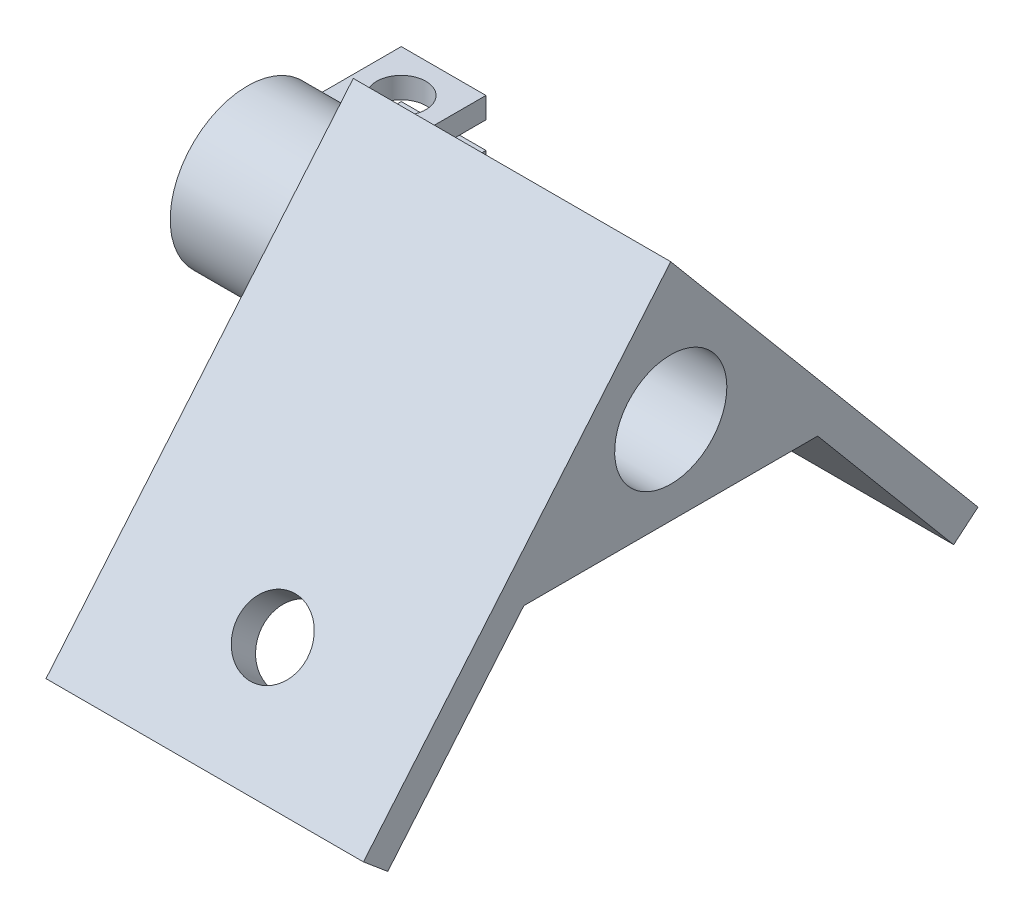
from build123d import *

# Parameters (mm, degrees)
SKETCH1_R            = 5.3
BOSS_EXTRUDE1_DEPTH  = 15
M6_CLEARANCE_HOLE1_D = 6.6
BOSS_EXTRUDE3_START  = 2
BOSS_EXTRUDE3_DEPTH  = 2
BOSS_EXTRUDE2_START  = 8
BOSS_EXTRUDE2_DEPTH  = 8
SKETCH6_R            = 2.325
CUT_EXTRUDE1_DEPTH   = 47.799531686


with BuildPart() as part:
    # Sketch1 → Boss-Extrude1 (new, symmetric)
    with BuildSketch(Plane(origin=(0, 0, 0), x_dir=(0, 0, -1), z_dir=(1, 0, 0))):
        Polygon((0, 12.912507763), (-29.037071095, -21.692526033), (-26.738937766, -23.620888862), (-13.883185572, -8.3), (13.883185572, -8.3), (26.738937766, -23.620888862), (29.037071095, -21.692526033), align=None)
        Circle(SKETCH1_R, mode=Mode.SUBTRACT)
    extrude(amount=BOSS_EXTRUDE1_DEPTH, both=True)

    # M6 Clearance Hole1 (through all)
    with Locations(Plane(origin=(0, 3.406774331, 4.060035549), x_dir=(-1, 0, 0), z_dir=(0, -0.6427876096865407, -0.766044443118977))):
        with Locations((0, -25.282108547)):
            m6_clearance_hole1 = Hole(M6_CLEARANCE_HOLE1_D / 2)

    # Mirror1: M6 Clearance Hole1 across plane
    add(m6_clearance_hole1.mirror(Plane.XY), mode=Mode.SUBTRACT)

    # Sketch7 → Boss-Extrude3 (add)
    with BuildSketch(Plane.ZY.offset(15).offset(BOSS_EXTRUDE3_START)):
        with BuildLine():
            Line((-5.150485414, 1.25), (-7.192183257, 1.25))
            ThreePointArc((-7.192183257, 1.25), (7.3, 0), (-7.192183257, -1.25))
            Line((-7.192183257, -1.25), (-5.150485414, -1.25))
            ThreePointArc((-5.150485414, -1.25), (5.3, 0), (-5.150485414, 1.25))
        make_face()
    extrude(amount=-BOSS_EXTRUDE3_DEPTH)

    # Sketch5 → Boss-Extrude2 (add)
    with BuildSketch(Plane.ZY.offset(17).offset(BOSS_EXTRUDE2_START)):
        with BuildLine():
            Line((-5.150485414, 1.25), (-14.536627571, 1.25))
            Line((-14.536627571, 1.25), (-14.536627571, 3.25))
            Line((-14.536627571, 3.25), (-6.536627571, 3.25))
            ThreePointArc((-6.536627571, 3.25), (7.3, 0), (-6.536627571, -3.25))
            Line((-6.536627571, -3.25), (-6.536627571, -10.25))
            Line((-6.536627571, -10.25), (-14.536627571, -10.25))
            Line((-14.536627571, -10.25), (-14.536627571, -1.25))
            Line((-14.536627571, -1.25), (-5.150485414, -1.25))
            ThreePointArc((-5.150485414, -1.25), (5.3, 0), (-5.150485414, 1.25))
        make_face()
    extrude(amount=-BOSS_EXTRUDE2_DEPTH)

    # Sketch6 → Cut-Extrude1 (cut, through all)
    with BuildSketch(Plane(origin=(0, 3.25, 0), x_dir=(1, 0, 0), z_dir=(0, 1, 0))):
        with Locations((-21, 10.536627571)):
            Circle(SKETCH6_R)
    extrude(amount=-CUT_EXTRUDE1_DEPTH, mode=Mode.SUBTRACT)


solid = part.part
